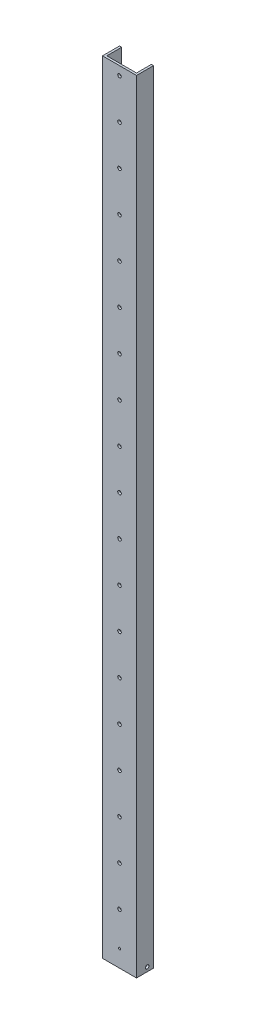
from build123d import *

# Parameters (mm, degrees)
BOSS_EXTRUDE1_DEPTH = 1168.4
IGUS_HOLES_REACH    = 1171.78
SKETCH2_R           = 2.667
CUT_EXTRUDE2_REACH  = 1171.715
SKETCH3_R           = 1.5875
SKETCH4_R           = 2.667
CUT_EXTRUDE3_DEPTH  = 1170.77962027


with BuildPart() as part:
    # Sketch1 → Boss-Extrude1 (new body)
    with BuildSketch(Plane(origin=(0, 0, 0), x_dir=(1, 0, 0), z_dir=(0, 1, 0))):
        Polygon((3.175, 3.175), (3.175, 25.4), (0, 25.4), (0, 0), (50.8, 0), (50.8, 25.4), (47.625, 25.4), (47.625, 3.175), align=None)
    extrude(amount=BOSS_EXTRUDE1_DEPTH)

    # Sketch2 → Igus_Holes (cut, up to next)
    with BuildSketch(Plane.XY, mode=Mode.PRIVATE) as igus_holes_sk1:
        with Locations((25.4, 76.2)):
            Circle(SKETCH2_R)
    igus_holes_tool1 = extrude(igus_holes_sk1.sketch, amount=-IGUS_HOLES_REACH, mode=Mode.PRIVATE) & part.part
    # Sketch2 → Igus_Holes (cut, up to next)
    with BuildSketch(Plane.XY, mode=Mode.PRIVATE) as igus_holes_sk2:
        with Locations((25.4, 136.144)):
            Circle(SKETCH2_R)
    igus_holes_tool2 = extrude(igus_holes_sk2.sketch, amount=-IGUS_HOLES_REACH, mode=Mode.PRIVATE) & part.part
    # Sketch2 → Igus_Holes (cut, up to next)
    with BuildSketch(Plane.XY, mode=Mode.PRIVATE) as igus_holes_sk3:
        with Locations((25.4, 196.088)):
            Circle(SKETCH2_R)
    igus_holes_tool3 = extrude(igus_holes_sk3.sketch, amount=-IGUS_HOLES_REACH, mode=Mode.PRIVATE) & part.part
    # Sketch2 → Igus_Holes (cut, up to next)
    with BuildSketch(Plane.XY, mode=Mode.PRIVATE) as igus_holes_sk4:
        with Locations((25.4, 256.032)):
            Circle(SKETCH2_R)
    igus_holes_tool4 = extrude(igus_holes_sk4.sketch, amount=-IGUS_HOLES_REACH, mode=Mode.PRIVATE) & part.part
    # Sketch2 → Igus_Holes (cut, up to next)
    with BuildSketch(Plane.XY, mode=Mode.PRIVATE) as igus_holes_sk5:
        with Locations((25.4, 315.976)):
            Circle(SKETCH2_R)
    igus_holes_tool5 = extrude(igus_holes_sk5.sketch, amount=-IGUS_HOLES_REACH, mode=Mode.PRIVATE) & part.part
    # Sketch2 → Igus_Holes (cut, up to next)
    with BuildSketch(Plane.XY, mode=Mode.PRIVATE) as igus_holes_sk6:
        with Locations((25.4, 375.92)):
            Circle(SKETCH2_R)
    igus_holes_tool6 = extrude(igus_holes_sk6.sketch, amount=-IGUS_HOLES_REACH, mode=Mode.PRIVATE) & part.part
    # Sketch2 → Igus_Holes (cut, up to next)
    with BuildSketch(Plane.XY, mode=Mode.PRIVATE) as igus_holes_sk7:
        with Locations((25.4, 435.864)):
            Circle(SKETCH2_R)
    igus_holes_tool7 = extrude(igus_holes_sk7.sketch, amount=-IGUS_HOLES_REACH, mode=Mode.PRIVATE) & part.part
    # Sketch2 → Igus_Holes (cut, up to next)
    with BuildSketch(Plane.XY, mode=Mode.PRIVATE) as igus_holes_sk8:
        with Locations((25.4, 495.808)):
            Circle(SKETCH2_R)
    igus_holes_tool8 = extrude(igus_holes_sk8.sketch, amount=-IGUS_HOLES_REACH, mode=Mode.PRIVATE) & part.part
    # Sketch2 → Igus_Holes (cut, up to next)
    with BuildSketch(Plane.XY, mode=Mode.PRIVATE) as igus_holes_sk9:
        with Locations((25.4, 555.752)):
            Circle(SKETCH2_R)
    igus_holes_tool9 = extrude(igus_holes_sk9.sketch, amount=-IGUS_HOLES_REACH, mode=Mode.PRIVATE) & part.part
    # Sketch2 → Igus_Holes (cut, up to next)
    with BuildSketch(Plane.XY, mode=Mode.PRIVATE) as igus_holes_sk10:
        with Locations((25.4, 615.696)):
            Circle(SKETCH2_R)
    igus_holes_tool10 = extrude(igus_holes_sk10.sketch, amount=-IGUS_HOLES_REACH, mode=Mode.PRIVATE) & part.part
    # Sketch2 → Igus_Holes (cut, up to next)
    with BuildSketch(Plane.XY, mode=Mode.PRIVATE) as igus_holes_sk11:
        with Locations((25.4, 675.64)):
            Circle(SKETCH2_R)
    igus_holes_tool11 = extrude(igus_holes_sk11.sketch, amount=-IGUS_HOLES_REACH, mode=Mode.PRIVATE) & part.part
    # Sketch2 → Igus_Holes (cut, up to next)
    with BuildSketch(Plane.XY, mode=Mode.PRIVATE) as igus_holes_sk12:
        with Locations((25.4, 735.584)):
            Circle(SKETCH2_R)
    igus_holes_tool12 = extrude(igus_holes_sk12.sketch, amount=-IGUS_HOLES_REACH, mode=Mode.PRIVATE) & part.part
    # Sketch2 → Igus_Holes (cut, up to next)
    with BuildSketch(Plane.XY, mode=Mode.PRIVATE) as igus_holes_sk13:
        with Locations((25.4, 795.528)):
            Circle(SKETCH2_R)
    igus_holes_tool13 = extrude(igus_holes_sk13.sketch, amount=-IGUS_HOLES_REACH, mode=Mode.PRIVATE) & part.part
    # Sketch2 → Igus_Holes (cut, up to next)
    with BuildSketch(Plane.XY, mode=Mode.PRIVATE) as igus_holes_sk14:
        with Locations((25.4, 855.472)):
            Circle(SKETCH2_R)
    igus_holes_tool14 = extrude(igus_holes_sk14.sketch, amount=-IGUS_HOLES_REACH, mode=Mode.PRIVATE) & part.part
    # Sketch2 → Igus_Holes (cut, up to next)
    with BuildSketch(Plane.XY, mode=Mode.PRIVATE) as igus_holes_sk15:
        with Locations((25.4, 915.416)):
            Circle(SKETCH2_R)
    igus_holes_tool15 = extrude(igus_holes_sk15.sketch, amount=-IGUS_HOLES_REACH, mode=Mode.PRIVATE) & part.part
    # Sketch2 → Igus_Holes (cut, up to next)
    with BuildSketch(Plane.XY, mode=Mode.PRIVATE) as igus_holes_sk16:
        with Locations((25.4, 975.36)):
            Circle(SKETCH2_R)
    igus_holes_tool16 = extrude(igus_holes_sk16.sketch, amount=-IGUS_HOLES_REACH, mode=Mode.PRIVATE) & part.part
    # Sketch2 → Igus_Holes (cut, up to next)
    with BuildSketch(Plane.XY, mode=Mode.PRIVATE) as igus_holes_sk17:
        with Locations((25.4, 1035.304)):
            Circle(SKETCH2_R)
    igus_holes_tool17 = extrude(igus_holes_sk17.sketch, amount=-IGUS_HOLES_REACH, mode=Mode.PRIVATE) & part.part
    # Sketch2 → Igus_Holes (cut, up to next)
    with BuildSketch(Plane.XY, mode=Mode.PRIVATE) as igus_holes_sk18:
        with Locations((25.4, 1095.248)):
            Circle(SKETCH2_R)
    igus_holes_tool18 = extrude(igus_holes_sk18.sketch, amount=-IGUS_HOLES_REACH, mode=Mode.PRIVATE) & part.part
    # Sketch2 → Igus_Holes (cut, up to next)
    with BuildSketch(Plane.XY, mode=Mode.PRIVATE) as igus_holes_sk19:
        with Locations((25.4, 1155.192)):
            Circle(SKETCH2_R)
    igus_holes_tool19 = extrude(igus_holes_sk19.sketch, amount=-IGUS_HOLES_REACH, mode=Mode.PRIVATE) & part.part
    add(igus_holes_tool1.solids().sort_by_distance((25.4, 76.2, 0))[0], mode=Mode.SUBTRACT)
    add(igus_holes_tool2.solids().sort_by_distance((25.4, 136.144, 0))[0], mode=Mode.SUBTRACT)
    add(igus_holes_tool3.solids().sort_by_distance((25.4, 196.088, 0))[0], mode=Mode.SUBTRACT)
    add(igus_holes_tool4.solids().sort_by_distance((25.4, 256.032, 0))[0], mode=Mode.SUBTRACT)
    add(igus_holes_tool5.solids().sort_by_distance((25.4, 315.976, 0))[0], mode=Mode.SUBTRACT)
    add(igus_holes_tool6.solids().sort_by_distance((25.4, 375.92, 0))[0], mode=Mode.SUBTRACT)
    add(igus_holes_tool7.solids().sort_by_distance((25.4, 435.864, 0))[0], mode=Mode.SUBTRACT)
    add(igus_holes_tool8.solids().sort_by_distance((25.4, 495.808, 0))[0], mode=Mode.SUBTRACT)
    add(igus_holes_tool9.solids().sort_by_distance((25.4, 555.752, 0))[0], mode=Mode.SUBTRACT)
    add(igus_holes_tool10.solids().sort_by_distance((25.4, 615.696, 0))[0], mode=Mode.SUBTRACT)
    add(igus_holes_tool11.solids().sort_by_distance((25.4, 675.64, 0))[0], mode=Mode.SUBTRACT)
    add(igus_holes_tool12.solids().sort_by_distance((25.4, 735.584, 0))[0], mode=Mode.SUBTRACT)
    add(igus_holes_tool13.solids().sort_by_distance((25.4, 795.528, 0))[0], mode=Mode.SUBTRACT)
    add(igus_holes_tool14.solids().sort_by_distance((25.4, 855.472, 0))[0], mode=Mode.SUBTRACT)
    add(igus_holes_tool15.solids().sort_by_distance((25.4, 915.416, 0))[0], mode=Mode.SUBTRACT)
    add(igus_holes_tool16.solids().sort_by_distance((25.4, 975.36, 0))[0], mode=Mode.SUBTRACT)
    add(igus_holes_tool17.solids().sort_by_distance((25.4, 1035.304, 0))[0], mode=Mode.SUBTRACT)
    add(igus_holes_tool18.solids().sort_by_distance((25.4, 1095.248, 0))[0], mode=Mode.SUBTRACT)
    add(igus_holes_tool19.solids().sort_by_distance((25.4, 1155.192, 0))[0], mode=Mode.SUBTRACT)

    # Sketch3 → Cut-Extrude2 (cut, up to next)
    with BuildSketch(Plane(origin=(0, 0, -3.175), x_dir=(-1, 0, 0), z_dir=(0, 0, -1)), mode=Mode.PRIVATE) as cut_extrude2_sk1:
        with Locations((-25.4, 25.4)):
            Circle(SKETCH3_R)
    cut_extrude2_tool1 = extrude(cut_extrude2_sk1.sketch, amount=-CUT_EXTRUDE2_REACH, mode=Mode.PRIVATE) & part.part
    add(cut_extrude2_tool1.solids().sort_by_distance((25.4, 25.4, -3.175))[0], mode=Mode.SUBTRACT)

    # Sketch4 → Cut-Extrude3 (cut, through all)
    with BuildSketch(Plane.ZY):
        with Locations((-15.875, 6.35)):
            Circle(SKETCH4_R)
    extrude(amount=-CUT_EXTRUDE3_DEPTH, mode=Mode.SUBTRACT)


solid = part.part
